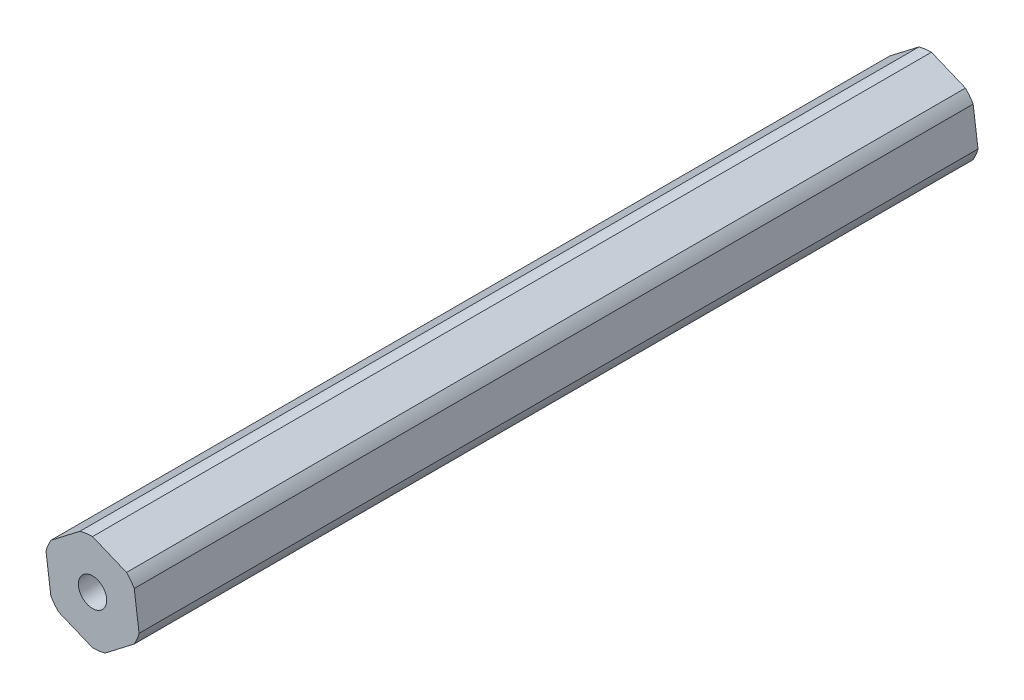
from build123d import *

# Parameters (mm, degrees)
BOSS_EXTRUDE1_DEPTH         = 119.6975
F_10_32_TAPPED_HOLE1_D      = 4.0386
F_10_32_TAPPED_HOLE1_DEPTH  = 13.6144
F_10_32_TAPPED_HOLE1_TIP    = 1.213317848
F_1_4_20_TAPPED_HOLE2_D     = 5.1054
F_1_4_20_TAPPED_HOLE2_DEPTH = 16.51
F_1_4_20_TAPPED_HOLE2_TIP   = 1.533816902


with BuildPart() as part:
    # Sketch1 → Boss-Extrude1 (new body)
    with BuildSketch(Plane.XY):
        with BuildLine():
            Line((-1.789892893, 6.63346078), (-5.950200742, 3.43535))
            ThreePointArc((-5.950200742, 3.43535), (-6.35, 2.623741315), (-6.639691997, 1.766637675))
            Line((-6.639691997, 1.766637675), (-5.950200742, -3.43535))
            ThreePointArc((-5.950200742, -3.43535), (-5.447226632, -4.187390656), (-4.849799104, -4.866823105))
            Line((-4.849799104, -4.866823105), (0, -6.8707))
            ThreePointArc((0, -6.8707), (0.902773368, -6.811131972), (1.789892893, -6.63346078))
            Line((1.789892893, -6.63346078), (5.950200742, -3.43535))
            ThreePointArc((5.950200742, -3.43535), (6.35, -2.623741315), (6.639691997, -1.766637675))
            Line((6.639691997, -1.766637675), (5.950200742, 3.43535))
            ThreePointArc((5.950200742, 3.43535), (5.447226632, 4.187390656), (4.849799104, 4.866823105))
            Line((4.849799104, 4.866823105), (0, 6.8707))
            ThreePointArc((0, 6.8707), (-0.902773368, 6.811131972), (-1.789892893, 6.63346078))
        make_face()
    extrude(amount=BOSS_EXTRUDE1_DEPTH)

    # #10-32 Tapped Hole1
    with Locations(Plane.XY.offset(119.6975)):
        with Locations((0, 0)):
            Hole(F_10_32_TAPPED_HOLE1_D / 2, depth=F_10_32_TAPPED_HOLE1_DEPTH)
            with Locations((0, 0, -(F_10_32_TAPPED_HOLE1_DEPTH + F_10_32_TAPPED_HOLE1_TIP / 2))):  # 118° drill point
                Cone(0, F_10_32_TAPPED_HOLE1_D / 2, F_10_32_TAPPED_HOLE1_TIP, mode=Mode.SUBTRACT)

    # 1/4-20 Tapped Hole2
    with Locations(Plane(origin=(0, 0, 0), x_dir=(-1, 0, 0), z_dir=(0, 0, -1))):
        with Locations((0, 0)):
            Hole(F_1_4_20_TAPPED_HOLE2_D / 2, depth=F_1_4_20_TAPPED_HOLE2_DEPTH)
            with Locations((0, 0, -(F_1_4_20_TAPPED_HOLE2_DEPTH + F_1_4_20_TAPPED_HOLE2_TIP / 2))):  # 118° drill point
                Cone(0, F_1_4_20_TAPPED_HOLE2_D / 2, F_1_4_20_TAPPED_HOLE2_TIP, mode=Mode.SUBTRACT)


solid = part.part
